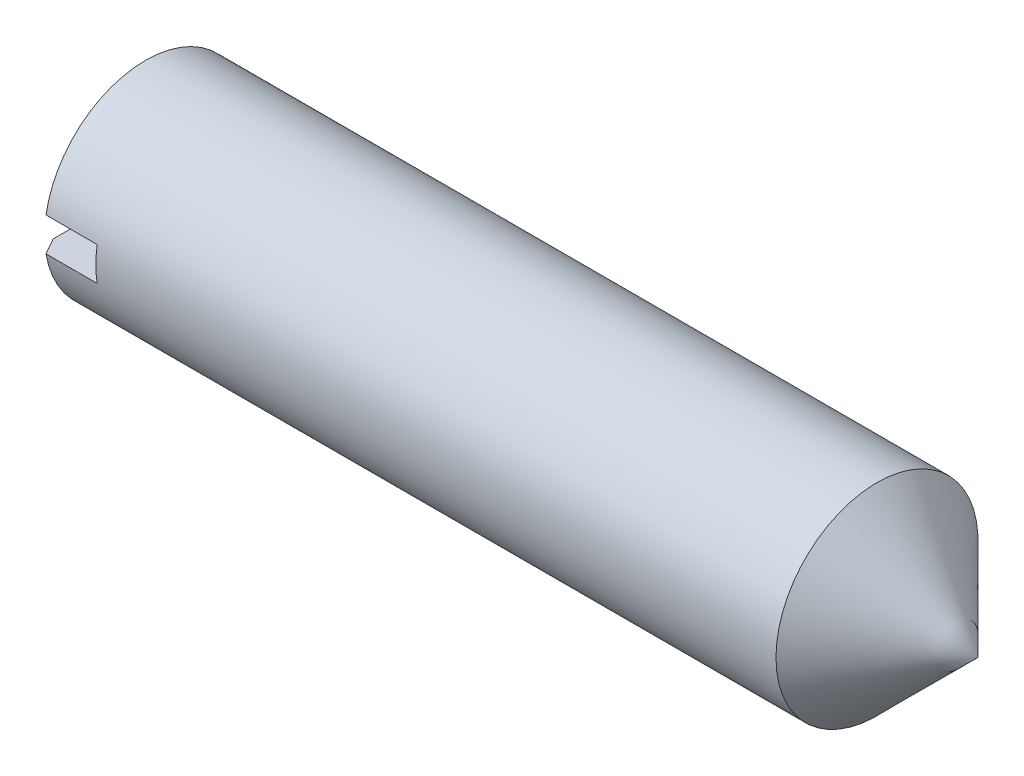
from build123d import *

# Parameters (mm, degrees)
SKETCH2_W  = 12
SKETCH2_H  = 2
SLOT_DEPTH = 3.6


with BuildPart() as part:
    # BodySke → BaseBody (revolve)
    with BuildSketch(Plane.XY):
        Polygon((0, 0), (0, 5.036), (0.556565659, 6), (44, 6), (50, 0), align=None)
    revolve(axis=Axis((-12.7, 0, 0), (1, 0, 0)))

    # Sketch2 → Slot (cut)
    with BuildSketch(Plane.ZY):
        Rectangle(SKETCH2_W, SKETCH2_H)
    extrude(amount=-SLOT_DEPTH, mode=Mode.SUBTRACT)


solid = part.part
